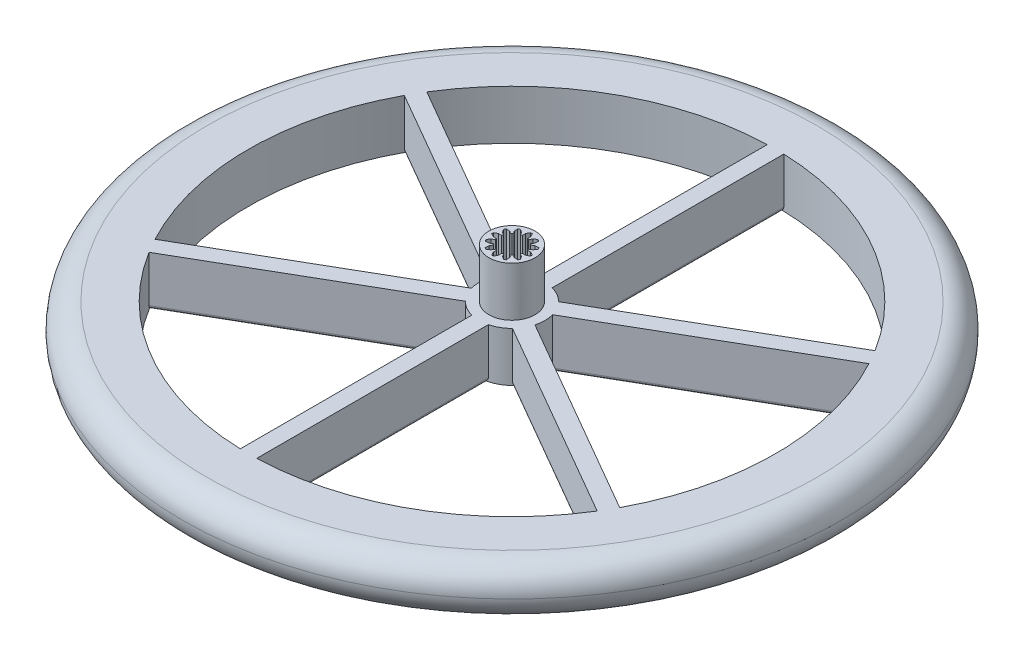
from build123d import *

# Parameters (mm, degrees)
SKETCH1_R           = 3.5
BOSS_EXTRUDE1_DEPTH = 7.5
SKETCH2_R           = 50
BOSS_EXTRUDE2_DEPTH = 7.5
SKETCH3_R           = 2
BOSS_EXTRUDE3_DEPTH = 1.5
FILLET1_R           = 3.75
FILLET2_R           = 0.5


with BuildPart() as part:
    # Sketch1 → Boss-Extrude1 (new body)
    with BuildSketch(Plane(origin=(0, 0, 0), x_dir=(1, 0, 0), z_dir=(0, 1, 0))):
        with Locations(Location((0, 0, 0), (0, 0, 270))):
            Circle(SKETCH1_R)
        with BuildLine():
            Line((0.633385736, 1.897056275), (0.871835675, 2.310063685))
            Line((0.871835675, 2.310063685), (1.338342026, 2.618076387))
            Line((1.338342026, 2.618076387), (1.598149647, 2.468076387))
            Line((1.598149647, 2.468076387), (1.564655998, 1.910063685))
            Line((1.564655998, 1.910063685), (1.326206059, 1.497056275))
            ThreePointArc((1.326206059, 1.497056275), (1.414213562, 1.414213562), (1.497056275, 1.326206059))
            Line((1.497056275, 1.326206059), (1.910063685, 1.564655998))
            Line((1.910063685, 1.564655998), (2.468076387, 1.598149647))
            Line((2.468076387, 1.598149647), (2.618076387, 1.338342026))
            Line((2.618076387, 1.338342026), (2.310063685, 0.871835675))
            Line((2.310063685, 0.871835675), (1.897056275, 0.633385736))
            ThreePointArc((1.897056275, 0.633385736), (1.931851653, 0.51763809), (1.959591794, 0.4))
            Line((1.959591794, 0.4), (2.436491673, 0.4))
            Line((2.436491673, 0.4), (2.936491673, 0.15))
            Line((2.936491673, 0.15), (2.936491673, -0.15))
            Line((2.936491673, -0.15), (2.436491673, -0.4))
            Line((2.436491673, -0.4), (1.959591794, -0.4))
            ThreePointArc((1.959591794, -0.4), (1.931851653, -0.51763809), (1.897056275, -0.633385736))
            Line((1.897056275, -0.633385736), (2.310063685, -0.871835675))
            Line((2.310063685, -0.871835675), (2.618076387, -1.338342026))
            Line((2.618076387, -1.338342026), (2.468076387, -1.598149647))
            Line((2.468076387, -1.598149647), (1.910063685, -1.564655998))
            Line((1.910063685, -1.564655998), (1.497056275, -1.326206059))
            ThreePointArc((1.497056275, -1.326206059), (1.414213562, -1.414213562), (1.326206059, -1.497056275))
            Line((1.326206059, -1.497056275), (1.564655998, -1.910063685))
            Line((1.564655998, -1.910063685), (1.598149647, -2.468076387))
            Line((1.598149647, -2.468076387), (1.338342026, -2.618076387))
            Line((1.338342026, -2.618076387), (0.871835675, -2.310063685))
            Line((0.871835675, -2.310063685), (0.633385736, -1.897056275))
            ThreePointArc((0.633385736, -1.897056275), (0.51763809, -1.931851653), (0.4, -1.959591794))
            Line((0.4, -1.959591794), (0.4, -2.436491673))
            Line((0.4, -2.436491673), (0.15, -2.936491673))
            Line((0.15, -2.936491673), (-0.15, -2.936491673))
            Line((-0.15, -2.936491673), (-0.4, -2.436491673))
            Line((-0.4, -2.436491673), (-0.4, -1.959591794))
            ThreePointArc((-0.4, -1.959591794), (-0.51763809, -1.931851653), (-0.633385736, -1.897056275))
            Line((-0.633385736, -1.897056275), (-0.871835675, -2.310063685))
            Line((-0.871835675, -2.310063685), (-1.338342026, -2.618076387))
            Line((-1.338342026, -2.618076387), (-1.598149647, -2.468076387))
            Line((-1.598149647, -2.468076387), (-1.564655998, -1.910063685))
            Line((-1.564655998, -1.910063685), (-1.326206059, -1.497056275))
            ThreePointArc((-1.326206059, -1.497056275), (-1.414213562, -1.414213562), (-1.497056275, -1.326206059))
            Line((-1.497056275, -1.326206059), (-1.910063685, -1.564655998))
            Line((-1.910063685, -1.564655998), (-2.468076387, -1.598149647))
            Line((-2.468076387, -1.598149647), (-2.618076387, -1.338342026))
            Line((-2.618076387, -1.338342026), (-2.310063685, -0.871835675))
            Line((-2.310063685, -0.871835675), (-1.897056275, -0.633385736))
            ThreePointArc((-1.897056275, -0.633385736), (-1.931851653, -0.51763809), (-1.959591794, -0.4))
            Line((-1.959591794, -0.4), (-2.436491673, -0.4))
            Line((-2.436491673, -0.4), (-2.936491673, -0.15))
            Line((-2.936491673, -0.15), (-2.936491673, 0.15))
            Line((-2.936491673, 0.15), (-2.436491673, 0.4))
            Line((-2.436491673, 0.4), (-1.959591794, 0.4))
            ThreePointArc((-1.959591794, 0.4), (-1.931851653, 0.51763809), (-1.897056275, 0.633385736))
            Line((-1.897056275, 0.633385736), (-2.310063685, 0.871835675))
            Line((-2.310063685, 0.871835675), (-2.618076387, 1.338342026))
            Line((-2.618076387, 1.338342026), (-2.468076387, 1.598149647))
            Line((-2.468076387, 1.598149647), (-1.910063685, 1.564655998))
            Line((-1.910063685, 1.564655998), (-1.497056275, 1.326206059))
            ThreePointArc((-1.497056275, 1.326206059), (-1.414213562, 1.414213562), (-1.326206059, 1.497056275))
            Line((-1.326206059, 1.497056275), (-1.564655998, 1.910063685))
            Line((-1.564655998, 1.910063685), (-1.598149647, 2.468076387))
            Line((-1.598149647, 2.468076387), (-1.338342026, 2.618076387))
            Line((-1.338342026, 2.618076387), (-0.871835675, 2.310063685))
            Line((-0.871835675, 2.310063685), (-0.633385736, 1.897056275))
            ThreePointArc((-0.633385736, 1.897056275), (-0.51763809, 1.931851653), (-0.4, 1.959591794))
            Line((-0.4, 1.959591794), (-0.4, 2.436491673))
            Line((-0.4, 2.436491673), (-0.15, 2.936491673))
            Line((-0.15, 2.936491673), (0.15, 2.936491673))
            Line((0.15, 2.936491673), (0.4, 2.436491673))
            Line((0.4, 2.436491673), (0.4, 1.959591794))
            ThreePointArc((0.4, 1.959591794), (0.51763809, 1.931851653), (0.633385736, 1.897056275))
        make_face(mode=Mode.SUBTRACT)
    extrude(amount=BOSS_EXTRUDE1_DEPTH)

    # Sketch2 → Boss-Extrude2 (add)
    with BuildSketch(Plane.XZ):
        with Locations(Location((0, 0, 0), (0, 0, 270))):
            Circle(SKETCH2_R)
        with BuildLine():
            Line((-1.25, -4.841229183), (-1.25, -39.980463979))
            ThreePointArc((-1.25, -39.980463979), (-20, -34.641016151), (-33.999097461, -21.072763744))
            Line((-33.999097461, -21.072763744), (-3.567627458, -3.503146346))
            ThreePointArc((-3.567627458, -3.503146346), (-2.5, -4.330127019), (-1.25, -4.841229183))
        make_face(mode=Mode.SUBTRACT)
        with BuildLine():
            Line((-4.817627458, -1.338082837), (-35.249097461, -18.907700235))
            ThreePointArc((-35.249097461, -18.907700235), (-40, 0), (-35.249097461, 18.907700235))
            Line((-35.249097461, 18.907700235), (-4.817627458, 1.338082837))
            ThreePointArc((-4.817627458, 1.338082837), (-5, 0), (-4.817627458, -1.338082837))
        make_face(mode=Mode.SUBTRACT)
        with BuildLine():
            Line((-3.567627458, 3.503146346), (-33.999097461, 21.072763744))
            ThreePointArc((-33.999097461, 21.072763744), (-20, 34.641016151), (-1.25, 39.980463979))
            Line((-1.25, 39.980463979), (-1.25, 4.841229183))
            ThreePointArc((-1.25, 4.841229183), (-2.5, 4.330127019), (-3.567627458, 3.503146346))
        make_face(mode=Mode.SUBTRACT)
        with BuildLine():
            Line((1.25, -4.841229183), (1.25, -39.980463979))
            ThreePointArc((1.25, -39.980463979), (20, -34.641016151), (33.999097461, -21.072763744))
            Line((33.999097461, -21.072763744), (3.567627458, -3.503146346))
            ThreePointArc((3.567627458, -3.503146346), (2.5, -4.330127019), (1.25, -4.841229183))
        make_face(mode=Mode.SUBTRACT)
        with BuildLine():
            Line((1.25, 4.841229183), (1.25, 39.980463979))
            ThreePointArc((1.25, 39.980463979), (20, 34.641016151), (33.999097461, 21.072763744))
            Line((33.999097461, 21.072763744), (3.567627458, 3.503146346))
            ThreePointArc((3.567627458, 3.503146346), (2.5, 4.330127019), (1.25, 4.841229183))
        make_face(mode=Mode.SUBTRACT)
        with BuildLine():
            Line((4.817627458, 1.338082837), (35.249097461, 18.907700235))
            ThreePointArc((35.249097461, 18.907700235), (40, 0), (35.249097461, -18.907700235))
            Line((35.249097461, -18.907700235), (4.817627458, -1.338082837))
            ThreePointArc((4.817627458, -1.338082837), (5, 0), (4.817627458, 1.338082837))
        make_face(mode=Mode.SUBTRACT)
    extrude(amount=BOSS_EXTRUDE2_DEPTH)

    # Sketch3 → Boss-Extrude3 (add)
    with BuildSketch(Plane(origin=(0, 0, 0), x_dir=(1, 0, 0), z_dir=(0, 1, 0))):
        with BuildLine():
            ThreePointArc((-0.633385736, -1.897056275), (-1, -1.732050808), (-1.326206059, -1.497056275))
            Line((-1.326206059, -1.497056275), (-1.564655998, -1.910063685))
            Line((-1.564655998, -1.910063685), (-1.598149647, -2.468076387))
            Line((-1.598149647, -2.468076387), (-1.338342026, -2.618076387))
            Line((-1.338342026, -2.618076387), (-0.871835675, -2.310063685))
            Line((-0.871835675, -2.310063685), (-0.633385736, -1.897056275))
        make_face()
        with BuildLine():
            Line((0.4, -2.436491673), (0.4, -1.959591794))
            ThreePointArc((0.4, -1.959591794), (0, -2), (-0.4, -1.959591794))
            Line((-0.4, -1.959591794), (-0.4, -2.436491673))
            Line((-0.4, -2.436491673), (-0.15, -2.936491673))
            Line((-0.15, -2.936491673), (0.15, -2.936491673))
            Line((0.15, -2.936491673), (0.4, -2.436491673))
        make_face()
        with BuildLine():
            Line((1.564655998, -1.910063685), (1.326206059, -1.497056275))
            ThreePointArc((1.326206059, -1.497056275), (1, -1.732050808), (0.633385736, -1.897056275))
            Line((0.633385736, -1.897056275), (0.871835675, -2.310063685))
            Line((0.871835675, -2.310063685), (1.338342026, -2.618076387))
            Line((1.338342026, -2.618076387), (1.598149647, -2.468076387))
            Line((1.598149647, -2.468076387), (1.564655998, -1.910063685))
        make_face()
        Circle(SKETCH3_R)
        with BuildLine():
            ThreePointArc((-1.497056275, -1.326206059), (-1.732050808, -1), (-1.897056275, -0.633385736))
            Line((-1.897056275, -0.633385736), (-2.310063685, -0.871835675))
            Line((-2.310063685, -0.871835675), (-2.618076387, -1.338342026))
            Line((-2.618076387, -1.338342026), (-2.468076387, -1.598149647))
            Line((-2.468076387, -1.598149647), (-1.910063685, -1.564655998))
            Line((-1.910063685, -1.564655998), (-1.497056275, -1.326206059))
        make_face()
        with BuildLine():
            ThreePointArc((-1.959591794, -0.4), (-2, 0), (-1.959591794, 0.4))
            Line((-1.959591794, 0.4), (-2.436491673, 0.4))
            Line((-2.436491673, 0.4), (-2.936491673, 0.15))
            Line((-2.936491673, 0.15), (-2.936491673, -0.15))
            Line((-2.936491673, -0.15), (-2.436491673, -0.4))
            Line((-2.436491673, -0.4), (-1.959591794, -0.4))
        make_face()
        with BuildLine():
            ThreePointArc((-1.897056275, 0.633385736), (-1.732050808, 1), (-1.497056275, 1.326206059))
            Line((-1.497056275, 1.326206059), (-1.910063685, 1.564655998))
            Line((-1.910063685, 1.564655998), (-2.468076387, 1.598149647))
            Line((-2.468076387, 1.598149647), (-2.618076387, 1.338342026))
            Line((-2.618076387, 1.338342026), (-2.310063685, 0.871835675))
            Line((-2.310063685, 0.871835675), (-1.897056275, 0.633385736))
        make_face()
        with BuildLine():
            ThreePointArc((-1.326206059, 1.497056275), (-1, 1.732050808), (-0.633385736, 1.897056275))
            Line((-0.633385736, 1.897056275), (-0.871835675, 2.310063685))
            Line((-0.871835675, 2.310063685), (-1.338342026, 2.618076387))
            Line((-1.338342026, 2.618076387), (-1.598149647, 2.468076387))
            Line((-1.598149647, 2.468076387), (-1.564655998, 1.910063685))
            Line((-1.564655998, 1.910063685), (-1.326206059, 1.497056275))
        make_face()
        with BuildLine():
            ThreePointArc((-0.4, 1.959591794), (0, 2), (0.4, 1.959591794))
            Line((0.4, 1.959591794), (0.4, 2.436491673))
            Line((0.4, 2.436491673), (0.15, 2.936491673))
            Line((0.15, 2.936491673), (-0.15, 2.936491673))
            Line((-0.15, 2.936491673), (-0.4, 2.436491673))
            Line((-0.4, 2.436491673), (-0.4, 1.959591794))
        make_face()
        with BuildLine():
            Line((1.338342026, 2.618076387), (0.871835675, 2.310063685))
            Line((0.871835675, 2.310063685), (0.633385736, 1.897056275))
            ThreePointArc((0.633385736, 1.897056275), (1, 1.732050808), (1.326206059, 1.497056275))
            Line((1.326206059, 1.497056275), (1.564655998, 1.910063685))
            Line((1.564655998, 1.910063685), (1.598149647, 2.468076387))
            Line((1.598149647, 2.468076387), (1.338342026, 2.618076387))
        make_face()
        with BuildLine():
            Line((1.910063685, 1.564655998), (1.497056275, 1.326206059))
            ThreePointArc((1.497056275, 1.326206059), (1.732050808, 1), (1.897056275, 0.633385736))
            Line((1.897056275, 0.633385736), (2.310063685, 0.871835675))
            Line((2.310063685, 0.871835675), (2.618076387, 1.338342026))
            Line((2.618076387, 1.338342026), (2.468076387, 1.598149647))
            Line((2.468076387, 1.598149647), (1.910063685, 1.564655998))
        make_face()
        with BuildLine():
            Line((2.436491673, 0.4), (1.959591794, 0.4))
            ThreePointArc((1.959591794, 0.4), (1.989872306, 0.201017924), (2, 0))
            ThreePointArc((2, 0), (1.989872306, -0.201017924), (1.959591794, -0.4))
            Line((1.959591794, -0.4), (2.436491673, -0.4))
            Line((2.436491673, -0.4), (2.936491673, -0.15))
            Line((2.936491673, -0.15), (2.936491673, 0.15))
            Line((2.936491673, 0.15), (2.436491673, 0.4))
        make_face()
        with BuildLine():
            Line((2.310063685, -0.871835675), (1.897056275, -0.633385736))
            ThreePointArc((1.897056275, -0.633385736), (1.732050808, -1), (1.497056275, -1.326206059))
            Line((1.497056275, -1.326206059), (1.910063685, -1.564655998))
            Line((1.910063685, -1.564655998), (2.468076387, -1.598149647))
            Line((2.468076387, -1.598149647), (2.618076387, -1.338342026))
            Line((2.618076387, -1.338342026), (2.310063685, -0.871835675))
        make_face()
    extrude(amount=BOSS_EXTRUDE3_DEPTH)

    # Fillet1
    fillet1_edges = [part.edges().sort_by_distance(p)[0] for p in [
        (0, -7.5, 50),
        (0, 0, 50),
    ]]
    fillet(fillet1_edges, radius=FILLET1_R - 0.0001)  # a hair under: the kernel refuses the full size

    # Fillet2
    fillet2_edges = [part.edges().sort_by_distance(p)[0] for p in [
        (-1.25, -7.5, -22.410846581),
        (-18.783362459, -7.5, -12.287955045),
        (-20.033362459, -7.5, -10.122891536),
        (-20.033362459, -7.5, 10.122891536),
        (-18.783362459, -7.5, 12.287955045),
        (-1.25, -7.5, 22.410846581),
        (18.783362459, -7.5, -12.287955045),
        (1.25, -7.5, -22.410846581),
        (1.25, -7.5, 22.410846581),
        (18.783362459, -7.5, 12.287955045),
        (20.033362459, -7.5, 10.122891536),
        (20.033362459, -7.5, -10.122891536),
    ]]
    fillet(fillet2_edges, radius=FILLET2_R)


solid = part.part
